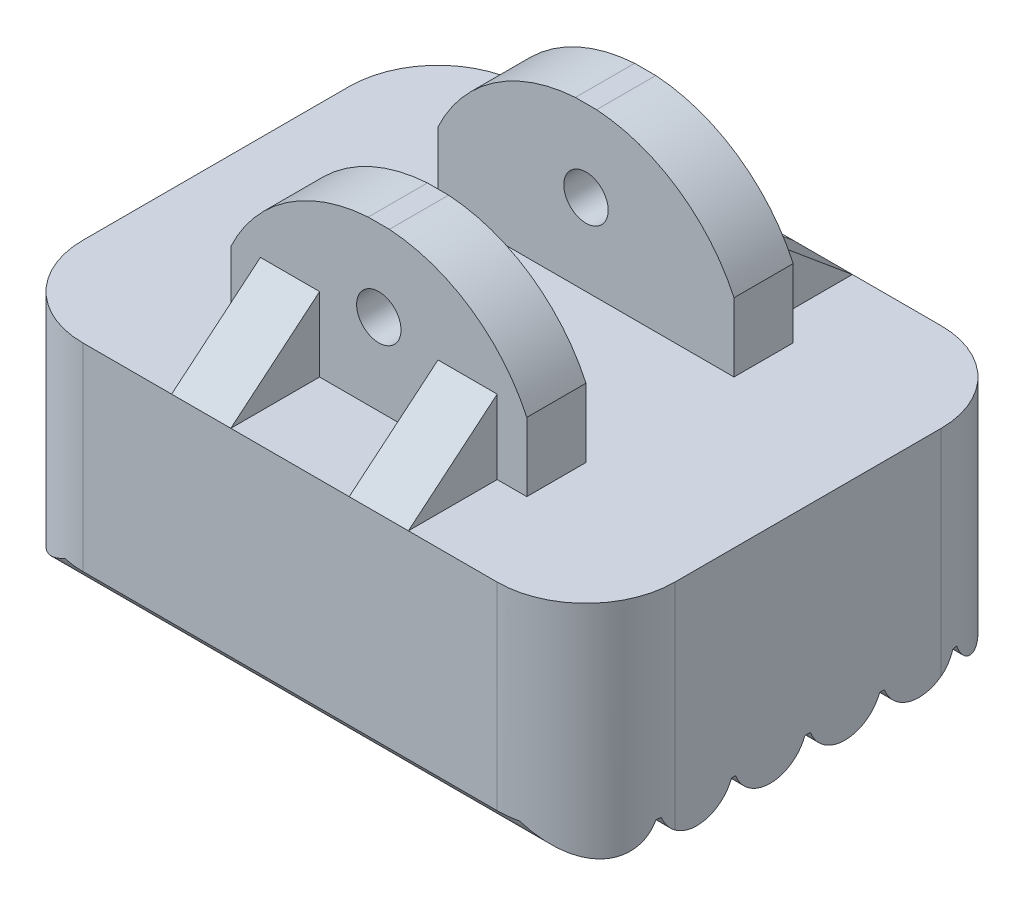
from build123d import *

# Parameters (mm, degrees)
SKETCH1_W           = 40
SKETCH1_H           = 30
BOSS_EXTRUDE1_DEPTH = 15
SKETCH2_W           = 20
SKETCH2_H           = 4
BOSS_EXTRUDE2_DEPTH = 11
SKETCH3_R           = 1.5
CUT_EXTRUDE1_DEPTH  = 20
SKETCH4_W           = 4
SKETCH4_H           = 6
BOSS_EXTRUDE3_DEPTH = 5
CUT_EXTRUDE2_DEPTH  = 21
FILLET7_R           = 6
FILLET8_R           = 6
FILLET9_R           = 6
FILLET10_R          = 6
CUT_EXTRUDE5_DEPTH  = 44


with BuildPart() as part:
    # Sketch1 → Boss-Extrude1 (new body)
    with BuildSketch(Plane(origin=(0, 0, 0), x_dir=(1, 0, 0), z_dir=(0, 1, 0))):
        with Locations((20, 15)):
            Rectangle(SKETCH1_W, SKETCH1_H)
    extrude(amount=BOSS_EXTRUDE1_DEPTH)

    # Sketch2 → Boss-Extrude2 (add)
    with BuildSketch(Plane(origin=(0, 15, 0), x_dir=(1, 0, 0), z_dir=(0, 1, 0))):
        with Locations((20, 22)):
            Rectangle(SKETCH2_W, SKETCH2_H)
        with Locations((20, 8)):
            Rectangle(SKETCH2_W, SKETCH2_H)
    extrude(amount=BOSS_EXTRUDE2_DEPTH)

    # Sketch3 → Cut-Extrude1 (cut)
    with BuildSketch(Plane.XY.offset(-6)):
        with BuildLine():
            Line((30, 26), (20.715749816, 26))
            ThreePointArc((20.715749816, 26), (26.230983436, 24.093247122), (30, 19.638135164))
            Line((30, 19.638135164), (30, 26))
        make_face()
        with BuildLine():
            Line((10, 26), (10, 19.638135164))
            ThreePointArc((10, 19.638135164), (13.769016564, 24.093247122), (19.284250184, 26))
            Line((19.284250184, 26), (10, 26))
        make_face()
        with Locations((20, 20.5)):
            Circle(SKETCH3_R)
    extrude(amount=-CUT_EXTRUDE1_DEPTH, mode=Mode.SUBTRACT)

    # Sketch4 → Boss-Extrude3 (add)
    with BuildSketch(Plane(origin=(0, 15, 0), x_dir=(1, 0, 0), z_dir=(0, 1, 0))):
        with Locations((14, 27)):
            Rectangle(SKETCH4_W, SKETCH4_H)
        with Locations((26, 27)):
            Rectangle(SKETCH4_W, SKETCH4_H)
        with Locations((14, 3)):
            Rectangle(SKETCH4_W, SKETCH4_H)
        with Locations((26, 3)):
            Rectangle(SKETCH4_W, SKETCH4_H)
    extrude(amount=BOSS_EXTRUDE3_DEPTH)

    # Sketch5 → Cut-Extrude2 (cut)
    with BuildSketch(Plane(origin=(28, 0, 0), x_dir=(0, 0, -1), z_dir=(1, 0, 0))):
        Polygon((0, 15), (0, 20), (6, 20), align=None)
        Polygon((24, 20), (30, 20), (30, 15), align=None)
    extrude(amount=-CUT_EXTRUDE2_DEPTH, mode=Mode.SUBTRACT)

    # Fillet7
    fillet7_edges = [part.edges().sort_by_distance(p)[0] for p in [
        (0, 7.5, 0),
    ]]
    fillet(fillet7_edges, radius=FILLET7_R)

    # Fillet8
    fillet8_edges = [part.edges().sort_by_distance(p)[0] for p in [
        (0, 7.5, -30),
    ]]
    fillet(fillet8_edges, radius=FILLET8_R)

    # Fillet9
    fillet9_edges = [part.edges().sort_by_distance(p)[0] for p in [
        (40, 7.5, -30),
    ]]
    fillet(fillet9_edges, radius=FILLET9_R)

    # Fillet10
    fillet10_edges = [part.edges().sort_by_distance(p)[0] for p in [
        (40, 7.5, 0),
    ]]
    fillet(fillet10_edges, radius=FILLET10_R)

    # Sketch6 → Cut-Extrude5 (cut)
    with BuildSketch(Plane.ZY):
        with BuildLine():
            Line((-29.841633208, 1.624355142), (-30, 1.624355142))
            Line((-30, 1.624355142), (-30, 0))
            Line((-30, 0), (-27.5, 0))
            ThreePointArc((-27.5, 0), (-28.924936464, 0.445844195), (-29.841633208, 1.624355142))
        make_face()
        with BuildLine():
            Line((-24.841633208, 1.624355142), (-25.158366792, 1.624355142))
            ThreePointArc((-25.158366792, 1.624355142), (-26.075063536, 0.445844195), (-27.5, 0))
            Line((-27.5, 0), (-22.5, 0))
            ThreePointArc((-22.5, 0), (-23.924936464, 0.445844195), (-24.841633208, 1.624355142))
        make_face()
        with BuildLine():
            ThreePointArc((-20.158366792, 1.624355142), (-21.075063536, 0.445844195), (-22.5, 0))
            Line((-22.5, 0), (-17.5, 0))
            ThreePointArc((-17.5, 0), (-18.924936464, 0.445844195), (-19.841633208, 1.624355142))
            Line((-19.841633208, 1.624355142), (-20.158366792, 1.624355142))
        make_face()
        with BuildLine():
            ThreePointArc((-15.158366792, 1.624355142), (-16.075063536, 0.445844195), (-17.5, 0))
            Line((-17.5, 0), (-12.446445225, 0))
            ThreePointArc((-12.446445225, 0), (-13.871381684, 0.445844197), (-14.788078425, 1.624355142))
            Line((-14.788078425, 1.624355142), (-15.158366792, 1.624355142))
        make_face()
        with BuildLine():
            ThreePointArc((-10.104812008, 1.624355142), (-11.021508756, 0.445844192), (-12.446445225, 0))
            Line((-12.446445225, 0), (-7.490821501, 0))
            ThreePointArc((-7.490821501, 0), (-8.915757965, 0.445844195), (-9.832454709, 1.624355142))
            Line((-9.832454709, 1.624355142), (-10.104812008, 1.624355142))
        make_face()
        with BuildLine():
            Line((-7.490821501, 0), (-2.495393592, 0))
            ThreePointArc((-2.495393592, 0), (-3.920330048, 0.445844198), (-4.837026787, 1.624355142))
            Line((-4.837026787, 1.624355142), (-5.149188292, 1.624355142))
            ThreePointArc((-5.149188292, 1.624355142), (-6.065885036, 0.445844195), (-7.490821501, 0))
        make_face()
        with BuildLine():
            ThreePointArc((-0.15376037, 1.624355142), (-1.07045712, 0.445844191), (-2.495393592, 0))
            Line((-2.495393592, 0), (0, 0))
            Line((0, 0), (0, 1.624355142))
            Line((0, 1.624355142), (-0.15376037, 1.624355142))
        make_face()
    extrude(amount=-CUT_EXTRUDE5_DEPTH, mode=Mode.SUBTRACT)


solid = part.part
